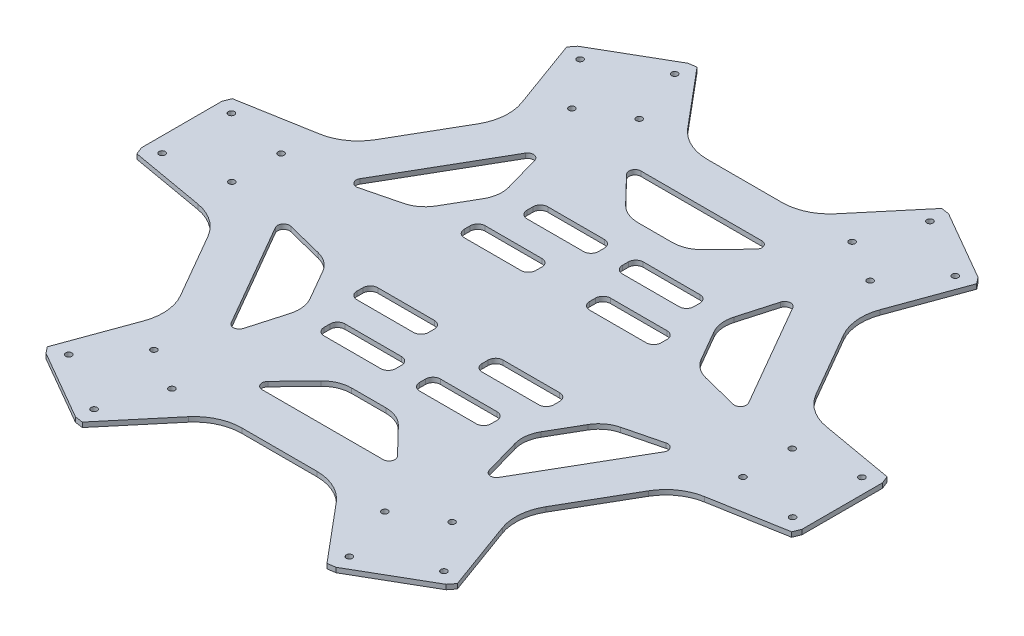
from build123d import *

# Parameters (mm, degrees)
BASE_PLATE_DEPTH                  = 1.6
FILLET3_R                         = 16
M2_5X0_45_TAPPED_HOLE1_AT_2_COUNT = 2
M2_5X0_45_TAPPED_HOLE1_AT_2_PITCH = 20.278621748
M2_5X0_45_TAPPED_HOLE1_AT_3_COUNT = 2
M2_5X0_45_TAPPED_HOLE1_AT_3_PITCH = 28.178404852
M2_5X0_45_TAPPED_HOLE1_AT_4_COUNT = 2
M2_5X0_45_TAPPED_HOLE1_AT_4_PITCH = 23.2
CIRPATTERN1_COUNT                 = 6
CUT_EXTRUDE1_REACH                = 153.283
FILLET4_R                         = 2
FILLET5_R                         = 10
CIRPATTERN2_COUNT                 = 6
FILLET4_OF_CIRPATTERN2_R          = 2
FILLET5_OF_CIRPATTERN2_R          = 10
CUT_EXTRUDE2_REACH                = 153.283
SKETCH8_W                         = 24
SKETCH8_H                         = 7
FILLET6_R                         = 2.5


with BuildPart() as part:
    # Sketch2 → Base plate (new body)
    with BuildSketch(Plane(origin=(0, 0, 0), x_dir=(1, 0, 0), z_dir=(0, 1, 0))):
        Polygon((-110.75, 13.5), (-110.75, -13.5), (-109.75, -16), (-77.558311744, -21.665063509), (-67.549981495, -39), (-57.541651246, -56.334936491), (-68.731406461, -87.046288065), (-67.066342951, -89.162313469), (-43.683657049, -102.662313469), (-41.018593539, -103.046288065), (-20.016660498, -78), (0, -78), (20.016660498, -78), (41.018593539, -103.046288065), (43.683657049, -102.662313469), (67.066342951, -89.162313469), (68.731406461, -87.046288065), (57.541651246, -56.334936491), (67.549981495, -39), (77.558311744, -21.665063509), (109.75, -16), (110.75, -13.5), (110.75, 13.5), (109.75, 16), (77.558311744, 21.665063509), (67.549981495, 39), (57.541651246, 56.334936491), (68.731406461, 87.046288065), (67.066342951, 89.162313469), (43.683657049, 102.662313469), (41.018593539, 103.046288065), (20.016660498, 78), (0, 78), (-20.016660498, 78), (-41.018593539, 103.046288065), (-43.683657049, 102.662313469), (-67.066342951, 89.162313469), (-68.731406461, 87.046288065), (-57.541651246, 56.334936491), (-67.549981495, 39), (-77.558311744, 21.665063509), (-109.75, 16), align=None)
    extrude(amount=BASE_PLATE_DEPTH)

    # Fillet3
    fillet3_edges = [part.edges().sort_by_distance(p)[0] for p in [
        (-57.541651246, 0.8, 56.334936491),
        (-77.558311744, 0.8, 21.665063509),
        (-20.016660498, 0.8, 78),
        (20.016660498, 0.8, 78),
        (57.541651246, 0.8, 56.334936491),
        (77.558311744, 0.8, 21.665063509),
        (77.558311744, 0.8, -21.665063509),
        (57.541651246, 0.8, -56.334936491),
        (20.016660498, 0.8, -78),
        (-20.016660498, 0.8, -78),
        (-57.541651246, 0.8, -56.334936491),
        (-77.558311744, 0.8, -21.665063509),
    ]]
    fillet(fillet3_edges, radius=FILLET3_R)

    # Sketch5 → M2.5x0.45 Tapped Hole1 (revolve, cut)
    with BuildSketch(Plane(origin=(-62.885894684, 1.6, -85.721564672), x_dir=(0, 0, 1), z_dir=(1, 0, 0))):
        Polygon((0, 0), (0, 6.965882135), (1.025, 6.35), (1.025, 0), align=None)
    m2_5x0_45_tapped_hole1 = revolve(axis=Axis((-62.885894684, 7.95, -85.721564672), (0, -1, 0)), mode=Mode.SUBTRACT)

    # M2.5x0.45 Tapped Hole1 at 2: M2.5x0.45 Tapped Hole1 ×2
    with Locations(*[Vector(0.6361963482023159, 0, 0.7715271910529387) * (i * M2_5X0_45_TAPPED_HOLE1_AT_2_PITCH) for i in range(1, M2_5X0_45_TAPPED_HOLE1_AT_2_COUNT)]):
        add(m2_5x0_45_tapped_hole1, mode=Mode.SUBTRACT)

    # M2.5x0.45 Tapped Hole1 at 3: M2.5x0.45 Tapped Hole1 ×2
    with Locations(*[Vector(0.9649447656099769, 0, 0.262453042127362) * (i * M2_5X0_45_TAPPED_HOLE1_AT_3_PITCH) for i in range(1, M2_5X0_45_TAPPED_HOLE1_AT_3_COUNT)]):
        add(m2_5x0_45_tapped_hole1, mode=Mode.SUBTRACT)

    # M2.5x0.45 Tapped Hole1 at 4: M2.5x0.45 Tapped Hole1 ×2
    with Locations(*[Vector(0.8660254037844395, 0, -0.4999999999999987) * (i * M2_5X0_45_TAPPED_HOLE1_AT_4_PITCH) for i in range(1, M2_5X0_45_TAPPED_HOLE1_AT_4_COUNT)]):
        add(m2_5x0_45_tapped_hole1, mode=Mode.SUBTRACT)

    # CirPattern1: M2.5x0.45 Tapped Hole1 ×6 about axis
    cirpattern1_axis = Axis((0, 0, 0), (0, 1, 0))
    for i in range(1, CIRPATTERN1_COUNT):
        add(m2_5x0_45_tapped_hole1.rotate(cirpattern1_axis, i * 360 / CIRPATTERN1_COUNT), mode=Mode.SUBTRACT)

    # CirPattern1 copy 1 sketch → CirPattern1 copy 1 (revolve, cut)
    with BuildSketch(Plane(origin=(-85.68, 1.6, 8.25), x_dir=(0.8660254037844386, 0, 0.5000000000000001), z_dir=(0.5000000000000001, 0, -0.8660254037844386))):
        Polygon((0, 0), (0, 6.965882135), (1.025, 6.35), (1.025, 0), align=None)
    revolve(axis=Axis((-85.68, 7.95, 8.25), (0, -1, 0)), mode=Mode.SUBTRACT)

    # CirPattern1 copy 2 sketch → CirPattern1 copy 2 (revolve, cut)
    with BuildSketch(Plane(origin=(-35.695290419, 1.6, 78.326056596), x_dir=(0.8660254037844387, 0, -0.4999999999999998), z_dir=(-0.4999999999999998, 0, -0.8660254037844387))):
        Polygon((0, 0), (0, 6.965882135), (1.025, 6.35), (1.025, 0), align=None)
    revolve(axis=Axis((-35.695290419, 7.95, 78.326056596), (0, -1, 0)), mode=Mode.SUBTRACT)

    # CirPattern1 copy 3 sketch → CirPattern1 copy 3 (revolve, cut)
    with BuildSketch(Plane(origin=(49.984709581, 1.6, 70.076056596), x_dir=(0, 0, -1), z_dir=(-1, 0, 0))):
        Polygon((0, 0), (0, 6.965882135), (1.025, 6.35), (1.025, 0), align=None)
    revolve(axis=Axis((49.984709581, 7.95, 70.076056596), (0, -1, 0)), mode=Mode.SUBTRACT)

    # CirPattern1 copy 4 sketch → CirPattern1 copy 4 (revolve, cut)
    with BuildSketch(Plane(origin=(85.68, 1.6, -8.25), x_dir=(-0.8660254037844384, 0, -0.5000000000000004), z_dir=(-0.5000000000000004, 0, 0.8660254037844384))):
        Polygon((0, 0), (0, 6.965882135), (1.025, 6.35), (1.025, 0), align=None)
    revolve(axis=Axis((85.68, 7.95, -8.25), (0, -1, 0)), mode=Mode.SUBTRACT)

    # CirPattern1 copy 5 sketch → CirPattern1 copy 5 (revolve, cut)
    with BuildSketch(Plane(origin=(35.695290419, 1.6, -78.326056596), x_dir=(-0.8660254037844386, 0, 0.5000000000000001), z_dir=(0.5000000000000001, 0, 0.8660254037844386))):
        Polygon((0, 0), (0, 6.965882135), (1.025, 6.35), (1.025, 0), align=None)
    revolve(axis=Axis((35.695290419, 7.95, -78.326056596), (0, -1, 0)), mode=Mode.SUBTRACT)

    # CirPattern1 copy 6 sketch → CirPattern1 copy 6 (revolve, cut)
    with BuildSketch(Plane(origin=(-85.68, 1.6, -8.25), x_dir=(0.8660254037844386, 0, 0.5000000000000001), z_dir=(0.5000000000000001, 0, -0.8660254037844386))):
        Polygon((0, 0), (0, 6.965882135), (1.025, 6.35), (1.025, 0), align=None)
    revolve(axis=Axis((-85.68, 7.95, -8.25), (0, -1, 0)), mode=Mode.SUBTRACT)

    # CirPattern1 copy 7 sketch → CirPattern1 copy 7 (revolve, cut)
    with BuildSketch(Plane(origin=(-49.984709581, 1.6, 70.076056596), x_dir=(0.8660254037844387, 0, -0.4999999999999998), z_dir=(-0.4999999999999998, 0, -0.8660254037844387))):
        Polygon((0, 0), (0, 6.965882135), (1.025, 6.35), (1.025, 0), align=None)
    revolve(axis=Axis((-49.984709581, 7.95, 70.076056596), (0, -1, 0)), mode=Mode.SUBTRACT)

    # CirPattern1 copy 8 sketch → CirPattern1 copy 8 (revolve, cut)
    with BuildSketch(Plane(origin=(35.695290419, 1.6, 78.326056596), x_dir=(0, 0, -1), z_dir=(-1, 0, 0))):
        Polygon((0, 0), (0, 6.965882135), (1.025, 6.35), (1.025, 0), align=None)
    revolve(axis=Axis((35.695290419, 7.95, 78.326056596), (0, -1, 0)), mode=Mode.SUBTRACT)

    # CirPattern1 copy 9 sketch → CirPattern1 copy 9 (revolve, cut)
    with BuildSketch(Plane(origin=(85.68, 1.6, 8.25), x_dir=(-0.8660254037844384, 0, -0.5000000000000004), z_dir=(-0.5000000000000004, 0, 0.8660254037844384))):
        Polygon((0, 0), (0, 6.965882135), (1.025, 6.35), (1.025, 0), align=None)
    revolve(axis=Axis((85.68, 7.95, 8.25), (0, -1, 0)), mode=Mode.SUBTRACT)

    # CirPattern1 copy 10 sketch → CirPattern1 copy 10 (revolve, cut)
    with BuildSketch(Plane(origin=(49.984709581, 1.6, -70.076056596), x_dir=(-0.8660254037844386, 0, 0.5000000000000001), z_dir=(0.5000000000000001, 0, 0.8660254037844386))):
        Polygon((0, 0), (0, 6.965882135), (1.025, 6.35), (1.025, 0), align=None)
    revolve(axis=Axis((49.984709581, 7.95, -70.076056596), (0, -1, 0)), mode=Mode.SUBTRACT)

    # CirPattern1 copy 11 sketch → CirPattern1 copy 11 (revolve, cut)
    with BuildSketch(Plane(origin=(-105.68, 1.6, -11.6), x_dir=(0.8660254037844386, 0, 0.5000000000000001), z_dir=(0.5000000000000001, 0, -0.8660254037844386))):
        Polygon((0, 0), (0, 6.965882135), (1.025, 6.35), (1.025, 0), align=None)
    revolve(axis=Axis((-105.68, 7.95, -11.6), (0, -1, 0)), mode=Mode.SUBTRACT)

    # CirPattern1 copy 12 sketch → CirPattern1 copy 12 (revolve, cut)
    with BuildSketch(Plane(origin=(-62.885894684, 1.6, 85.721564672), x_dir=(0.8660254037844387, 0, -0.4999999999999998), z_dir=(-0.4999999999999998, 0, -0.8660254037844387))):
        Polygon((0, 0), (0, 6.965882135), (1.025, 6.35), (1.025, 0), align=None)
    revolve(axis=Axis((-62.885894684, 7.95, 85.721564672), (0, -1, 0)), mode=Mode.SUBTRACT)

    # CirPattern1 copy 13 sketch → CirPattern1 copy 13 (revolve, cut)
    with BuildSketch(Plane(origin=(42.794105316, 1.6, 97.321564672), x_dir=(0, 0, -1), z_dir=(-1, 0, 0))):
        Polygon((0, 0), (0, 6.965882135), (1.025, 6.35), (1.025, 0), align=None)
    revolve(axis=Axis((42.794105316, 7.95, 97.321564672), (0, -1, 0)), mode=Mode.SUBTRACT)

    # CirPattern1 copy 14 sketch → CirPattern1 copy 14 (revolve, cut)
    with BuildSketch(Plane(origin=(105.68, 1.6, 11.6), x_dir=(-0.8660254037844384, 0, -0.5000000000000004), z_dir=(-0.5000000000000004, 0, 0.8660254037844384))):
        Polygon((0, 0), (0, 6.965882135), (1.025, 6.35), (1.025, 0), align=None)
    revolve(axis=Axis((105.68, 7.95, 11.6), (0, -1, 0)), mode=Mode.SUBTRACT)

    # CirPattern1 copy 15 sketch → CirPattern1 copy 15 (revolve, cut)
    with BuildSketch(Plane(origin=(62.885894684, 1.6, -85.721564672), x_dir=(-0.8660254037844386, 0, 0.5000000000000001), z_dir=(0.5000000000000001, 0, 0.8660254037844386))):
        Polygon((0, 0), (0, 6.965882135), (1.025, 6.35), (1.025, 0), align=None)
    revolve(axis=Axis((62.885894684, 7.95, -85.721564672), (0, -1, 0)), mode=Mode.SUBTRACT)

    # Sketch7 → Cut-Extrude1 (cut, up to next)
    with BuildSketch(Plane(origin=(0, 1.6, 0), x_dir=(1, 0, 0), z_dir=(0, 1, 0)), mode=Mode.PRIVATE) as cut_extrude1_sk1:
        Polygon((25, 63.5), (-25, 63.5), (-10, 48), (10, 48), align=None)
    cut_extrude1_tool1 = extrude(cut_extrude1_sk1.sketch, amount=-CUT_EXTRUDE1_REACH, mode=Mode.PRIVATE) & part.part
    cut_extrude1 = cut_extrude1_tool1.solids().sort_by_distance((0, 1.6, -56.857143))[0]
    add(cut_extrude1, mode=Mode.SUBTRACT)

    # Fillet4
    fillet4_edges = [part.edges().sort_by_distance(p)[0] for p in [
        (-25, 0.8, -63.5),
        (25, 0.8, -63.5),
    ]]
    fillet(fillet4_edges, radius=FILLET4_R)

    # Fillet5
    fillet5_edges = [part.edges().sort_by_distance(p)[0] for p in [
        (10, 0.8, -48),
        (-10, 0.8, -48),
    ]]
    fillet(fillet5_edges, radius=FILLET5_R)

    # CirPattern2: Cut-Extrude1 ×6 about axis
    cirpattern2_axis = Axis((0, 0, 0), (0, 1, 0))
    for i in range(1, CIRPATTERN2_COUNT):
        add(cut_extrude1.rotate(cirpattern2_axis, i * 360 / CIRPATTERN2_COUNT), mode=Mode.SUBTRACT)

    # Fillet4 of CirPattern2
    fillet4_of_cirpattern2_edges = [part.edges().sort_by_distance(p)[0] for p in [
        (-67.49261314, 0.8, -10.099364905),
        (-42.49261314, 0.8, -53.400635095),
        (-42.49261314, 0.8, 53.400635095),
        (-67.49261314, 0.8, 10.099364905),
        (25, 0.8, 63.5),
        (-25, 0.8, 63.5),
        (67.49261314, 0.8, 10.099364905),
        (42.49261314, 0.8, 53.400635095),
        (42.49261314, 0.8, -53.400635095),
        (67.49261314, 0.8, -10.099364905),
    ]]
    fillet(fillet4_of_cirpattern2_edges, radius=FILLET4_OF_CIRPATTERN2_R)

    # Fillet5 of CirPattern2
    fillet5_of_cirpattern2_edges = [part.edges().sort_by_distance(p)[0] for p in [
        (-36.569219382, 0.8, -32.660254038),
        (-46.569219382, 0.8, -15.339745962),
        (-46.569219382, 0.8, 15.339745962),
        (-36.569219382, 0.8, 32.660254038),
        (-10, 0.8, 48),
        (10, 0.8, 48),
        (36.569219382, 0.8, 32.660254038),
        (46.569219382, 0.8, 15.339745962),
        (46.569219382, 0.8, -15.339745962),
        (36.569219382, 0.8, -32.660254038),
    ]]
    fillet(fillet5_of_cirpattern2_edges, radius=FILLET5_OF_CIRPATTERN2_R)

    # Sketch8 → Cut-Extrude2 (cut, up to next)
    with BuildSketch(Plane(origin=(0, 1.6, 0), x_dir=(1, 0, 0), z_dir=(0, 1, 0)), mode=Mode.PRIVATE) as cut_extrude2_sk1:
        with Locations((-16, 34)):
            Rectangle(SKETCH8_W, SKETCH8_H)
    cut_extrude2_tool1 = extrude(cut_extrude2_sk1.sketch, amount=-CUT_EXTRUDE2_REACH, mode=Mode.PRIVATE) & part.part
    # Sketch8 → Cut-Extrude2 (cut, up to next)
    with BuildSketch(Plane(origin=(0, 1.6, 0), x_dir=(1, 0, 0), z_dir=(0, 1, 0)), mode=Mode.PRIVATE) as cut_extrude2_sk2:
        with Locations((-21, 18)):
            Rectangle(SKETCH8_W, SKETCH8_H)
    cut_extrude2_tool2 = extrude(cut_extrude2_sk2.sketch, amount=-CUT_EXTRUDE2_REACH, mode=Mode.PRIVATE) & part.part
    # Sketch8 → Cut-Extrude2 (cut, up to next)
    with BuildSketch(Plane(origin=(0, 1.6, 0), x_dir=(1, 0, 0), z_dir=(0, 1, 0)), mode=Mode.PRIVATE) as cut_extrude2_sk3:
        with Locations((16, 34)):
            Rectangle(SKETCH8_W, SKETCH8_H)
    cut_extrude2_tool3 = extrude(cut_extrude2_sk3.sketch, amount=-CUT_EXTRUDE2_REACH, mode=Mode.PRIVATE) & part.part
    # Sketch8 → Cut-Extrude2 (cut, up to next)
    with BuildSketch(Plane(origin=(0, 1.6, 0), x_dir=(1, 0, 0), z_dir=(0, 1, 0)), mode=Mode.PRIVATE) as cut_extrude2_sk4:
        with Locations((21, 18)):
            Rectangle(SKETCH8_W, SKETCH8_H)
    cut_extrude2_tool4 = extrude(cut_extrude2_sk4.sketch, amount=-CUT_EXTRUDE2_REACH, mode=Mode.PRIVATE) & part.part
    # Sketch8 → Cut-Extrude2 (cut, up to next)
    with BuildSketch(Plane(origin=(0, 1.6, 0), x_dir=(1, 0, 0), z_dir=(0, 1, 0)), mode=Mode.PRIVATE) as cut_extrude2_sk5:
        with Locations((21, -18)):
            Rectangle(SKETCH8_W, SKETCH8_H)
    cut_extrude2_tool5 = extrude(cut_extrude2_sk5.sketch, amount=-CUT_EXTRUDE2_REACH, mode=Mode.PRIVATE) & part.part
    # Sketch8 → Cut-Extrude2 (cut, up to next)
    with BuildSketch(Plane(origin=(0, 1.6, 0), x_dir=(1, 0, 0), z_dir=(0, 1, 0)), mode=Mode.PRIVATE) as cut_extrude2_sk6:
        with Locations((16, -34)):
            Rectangle(SKETCH8_W, SKETCH8_H)
    cut_extrude2_tool6 = extrude(cut_extrude2_sk6.sketch, amount=-CUT_EXTRUDE2_REACH, mode=Mode.PRIVATE) & part.part
    # Sketch8 → Cut-Extrude2 (cut, up to next)
    with BuildSketch(Plane(origin=(0, 1.6, 0), x_dir=(1, 0, 0), z_dir=(0, 1, 0)), mode=Mode.PRIVATE) as cut_extrude2_sk7:
        with Locations((-21, -18)):
            Rectangle(SKETCH8_W, SKETCH8_H)
    cut_extrude2_tool7 = extrude(cut_extrude2_sk7.sketch, amount=-CUT_EXTRUDE2_REACH, mode=Mode.PRIVATE) & part.part
    # Sketch8 → Cut-Extrude2 (cut, up to next)
    with BuildSketch(Plane(origin=(0, 1.6, 0), x_dir=(1, 0, 0), z_dir=(0, 1, 0)), mode=Mode.PRIVATE) as cut_extrude2_sk8:
        with Locations((-16, -34)):
            Rectangle(SKETCH8_W, SKETCH8_H)
    cut_extrude2_tool8 = extrude(cut_extrude2_sk8.sketch, amount=-CUT_EXTRUDE2_REACH, mode=Mode.PRIVATE) & part.part
    add(cut_extrude2_tool1.solids().sort_by_distance((-16, 1.6, -34))[0], mode=Mode.SUBTRACT)
    add(cut_extrude2_tool2.solids().sort_by_distance((-21, 1.6, -18))[0], mode=Mode.SUBTRACT)
    add(cut_extrude2_tool3.solids().sort_by_distance((16, 1.6, -34))[0], mode=Mode.SUBTRACT)
    add(cut_extrude2_tool4.solids().sort_by_distance((21, 1.6, -18))[0], mode=Mode.SUBTRACT)
    add(cut_extrude2_tool5.solids().sort_by_distance((21, 1.6, 18))[0], mode=Mode.SUBTRACT)
    add(cut_extrude2_tool6.solids().sort_by_distance((16, 1.6, 34))[0], mode=Mode.SUBTRACT)
    add(cut_extrude2_tool7.solids().sort_by_distance((-21, 1.6, 18))[0], mode=Mode.SUBTRACT)
    add(cut_extrude2_tool8.solids().sort_by_distance((-16, 1.6, 34))[0], mode=Mode.SUBTRACT)

    # Fillet6
    fillet6_edges = [part.edges().sort_by_distance(p)[0] for p in [
        (-9, 0.8, -21.5),
        (-9, 0.8, -14.5),
        (-33, 0.8, -14.5),
        (-33, 0.8, -21.5),
        (-4, 0.8, -30.5),
        (-28, 0.8, -30.5),
        (-28, 0.8, -37.5),
        (-4, 0.8, -37.5),
        (-9, 0.8, 21.5),
        (-33, 0.8, 14.5),
        (-28, 0.8, 30.5),
        (-4, 0.8, 37.5),
        (-33, 0.8, 21.5),
        (-28, 0.8, 37.5),
        (4, 0.8, 37.5),
        (9, 0.8, 21.5),
        (9, 0.8, 14.5),
        (4, 0.8, 30.5),
        (-4, 0.8, 30.5),
        (-9, 0.8, 14.5),
        (28, 0.8, 30.5),
        (28, 0.8, 37.5),
        (33, 0.8, 21.5),
        (33, 0.8, 14.5),
        (33, 0.8, -21.5),
        (28, 0.8, -37.5),
        (28, 0.8, -30.5),
        (33, 0.8, -14.5),
        (4, 0.8, -30.5),
        (4, 0.8, -37.5),
        (9, 0.8, -21.5),
        (9, 0.8, -14.5),
    ]]
    fillet(fillet6_edges, radius=FILLET6_R)


solid = part.part
